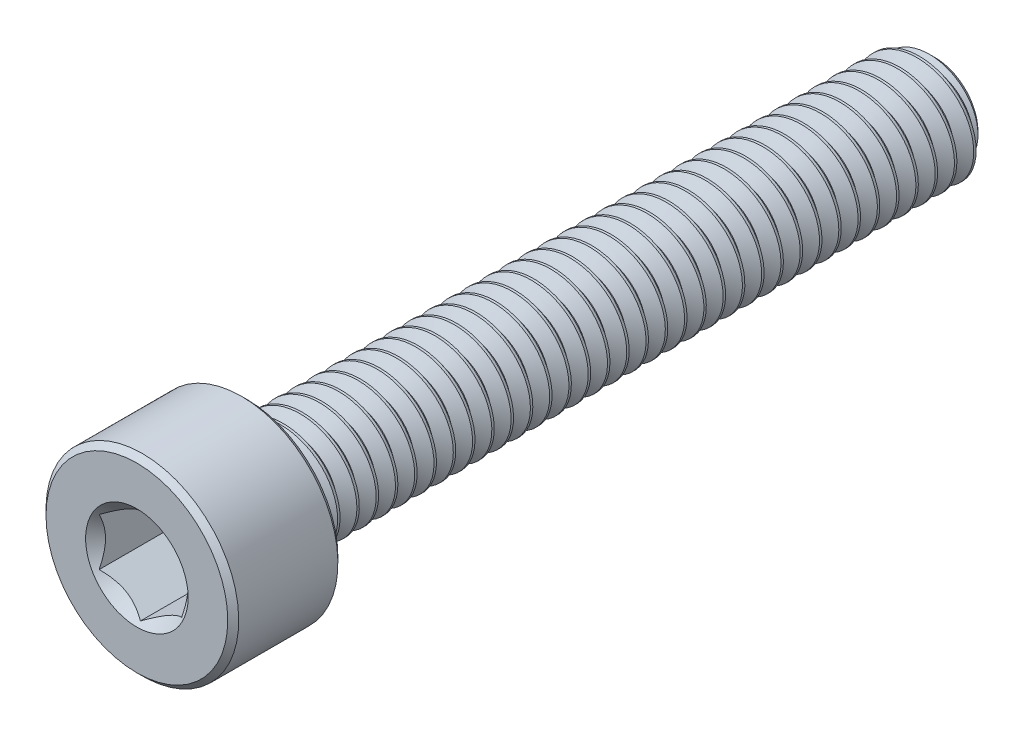
from build123d import *

# Parameters (mm, degrees)
CUT_EXTRUDE1_DEPTH     = 3
SPLIT1_SURFACE_1_BACK  = 31.643
SPLIT1_SURFACE_1_DEPTH = 63.286
SPLIT1_SURFACE_2_BACK  = 31.643
SPLIT1_SURFACE_2_DEPTH = 63.286
CUT_SWEEP1_PITCH       = 0.7
CUT_SWEEP1_TO          = 24.8


with BuildPart() as part:
    # Sketch2 → Revolve1 (revolve)
    with BuildSketch(Plane(origin=(0, 0, 0), x_dir=(0, 0, -1), z_dir=(1, 0, 0))):
        with BuildLine():
            Line((-14.5, 0), (-14.5, 3.3))
            Line((-14.5, 3.3), (-14.3, 3.5))
            Line((-14.3, 3.5), (-10.7, 3.5))
            Line((-10.7, 3.5), (-10.5, 3.3))
            Line((-10.5, 3.3), (-10.5, 2.2))
            ThreePointArc((-10.5, 2.2), (-10.441421356, 2.058578644), (-10.3, 2))
            Line((-10.3, 2), (14.045336663, 2))
            Line((14.045336663, 2), (14.5, 1.545336663))
            Line((14.5, 1.545336663), (14.5, 0))
            Line((14.5, 0), (-14.5, 0))
        make_face()
    revolve(axis=Axis((0, 0, -14.5), (0, 0, 1)))

    # Sketch3 → Cut-Extrude1 (cut)
    with BuildSketch(Plane.XY.offset(14.5)):
        Polygon((1.5, -0.866025404), (1.5, 0.866025404), (0, 1.732050808), (-1.5, 0.866025404), (-1.5, -0.866025404), (0, -1.732050808), align=None)
    extrude(amount=-CUT_EXTRUDE1_DEPTH, mode=Mode.SUBTRACT)

    # Cut-Extrude2 cone 1 section (through the dimple's axis) → Cut-Extrude2 (revolve, cut)
    with BuildSketch(Plane(origin=(0, 0, 14.5), x_dir=(0, -1, 0), z_dir=(1, 0, 0))):
        Polygon((0, 0), (1.861954618, 0), (0, 1.861954618), align=None)
    revolve(axis=Axis((0, 0, 14.5), (0, 0, -1)), mode=Mode.SUBTRACT)


with BuildPart() as body_2:
    # Split1: the piece behind the surface
    add(part.part)
    # Split1 surface: a surface, the sketch's curves swept straight by 63.286 mm
    with BuildLine(Plane(origin=(0, 0, 0), x_dir=(0, 0, -1), z_dir=(1, 0, 0)).offset(-SPLIT1_SURFACE_1_BACK), mode=Mode.PRIVATE) as split1_surface_1_path:
        Line((-10.3, -3.5), (-10.3, 3.5))
    split1_surface_1 = Shell.extrude(split1_surface_1_path.wire(), (1 * SPLIT1_SURFACE_1_DEPTH, 0 * SPLIT1_SURFACE_1_DEPTH, 0 * SPLIT1_SURFACE_1_DEPTH))
    split(bisect_by=split1_surface_1, keep=Keep.BOTTOM)

    # Cut-Sweep1: arcs per turn and ends read off the stored shape
    # Cut-Sweep1: the profile of Sketch7 screwed along a right-hand helix through 36.714286 turns, 6 arcs to a turn; built about Z, then put on its axis
    cut_sweep1_z = Axis((0, 0, 0), (0, 0, 1))
    cut_sweep1_corners = [(2.037888611, 0, 0.021875), (2.037888611, 0, -0.634375), (1.545336663, 0, -0.35), (1.545336663, 0, -0.2625)]
    with BuildLine(mode=Mode.PRIVATE) as cut_sweep1_profile:
        Line(cut_sweep1_corners[0], cut_sweep1_corners[1])
        Line(cut_sweep1_corners[1], cut_sweep1_corners[2])
        Line(cut_sweep1_corners[2], cut_sweep1_corners[3])
        Line(cut_sweep1_corners[3], cut_sweep1_corners[0])
    cut_sweep1_cap = Face(cut_sweep1_profile.wire())
    cut_sweep1_turn_angles = [0, 30, 60, 90, 120, 150, 180, 210, 240, 270, 300, 330, 360]
    cut_sweep1_turn_weights = [1, 0.8660254037844387, 1, 0.8660254037844387, 1, 0.8660254037844387, 1, 0.8660254037844387, 1, 0.8660254037844387, 1, 0.8660254037844387, 1]
    cut_sweep1_turn_rails = [Edge.make_bspline([Vector(p[0], p[1], 0).rotate(cut_sweep1_z, cut_sweep1_turn_angles[k]) / cut_sweep1_turn_weights[k] + Vector(0, 0, p[2] + CUT_SWEEP1_PITCH * cut_sweep1_turn_angles[k] / 360) for k in range(13)], [0, 0, 0, 1, 1, 2, 2, 3, 3, 4, 4, 5, 5, 6, 6, 6], 2, cut_sweep1_turn_weights) for p in cut_sweep1_corners]
    cut_sweep1_turn_sides = [Face.make_surface_from_curves(cut_sweep1_turn_rails[p[0]], cut_sweep1_turn_rails[p[1]]) for p in [(0, 1), (1, 2), (2, 3), (3, 0)]]
    cut_sweep1_last_angles = [12960, 12990, 13020, 13050, 13080, 13110, 13140, 13170, 13200, 13208.571428571, 13217.142857142]
    cut_sweep1_last_weights = [1, 0.8660254037844387, 1, 0.8660254037844387, 1, 0.8660254037844387, 1, 0.8660254037844387, 1, 0.9888308262256825, 1]
    cut_sweep1_last_rails = [Edge.make_bspline([Vector(p[0], p[1], 0).rotate(cut_sweep1_z, cut_sweep1_last_angles[k]) / cut_sweep1_last_weights[k] + Vector(0, 0, p[2] + CUT_SWEEP1_PITCH * cut_sweep1_last_angles[k] / 360) for k in range(11)], [0, 0, 0, 1, 1, 2, 2, 3, 3, 4, 4, 5, 5, 5], 2, cut_sweep1_last_weights) for p in cut_sweep1_corners]
    cut_sweep1_last_sides = [Face.make_surface_from_curves(cut_sweep1_last_rails[p[0]], cut_sweep1_last_rails[p[1]]) for p in [(0, 1), (1, 2), (2, 3), (3, 0)]]
    cut_sweep1 = Plane(origin=(0, 0, -14.5), x_dir=(0, 1, 0), z_dir=(0, 0, 1)) * split(Solid(Shell([*[p.moved(Location((0, 0, CUT_SWEEP1_PITCH * i))) for i in range(36) for p in cut_sweep1_turn_sides], *cut_sweep1_last_sides, cut_sweep1_cap, cut_sweep1_cap.rotate(cut_sweep1_z, 13217.142857142).moved(Location((0, 0, CUT_SWEEP1_PITCH * 13217.142857142 / 360)))])), bisect_by=Plane.XY.offset(CUT_SWEEP1_TO), keep=Keep.BOTTOM, mode=Mode.PRIVATE)
    add(cut_sweep1, mode=Mode.SUBTRACT)


with BuildPart() as part_1:
    add(part.part)

    # Split1: split by a surface, the side it looks to stays
    # Split1 surface: a surface, the sketch's curves swept straight by 63.286 mm
    with BuildLine(Plane(origin=(0, 0, 0), x_dir=(0, 0, -1), z_dir=(1, 0, 0)).offset(-SPLIT1_SURFACE_2_BACK), mode=Mode.PRIVATE) as split1_surface_2_path:
        Line((-10.3, -3.5), (-10.3, 3.5))
    split1_surface_2 = Shell.extrude(split1_surface_2_path.wire(), (1 * SPLIT1_SURFACE_2_DEPTH, 0 * SPLIT1_SURFACE_2_DEPTH, 0 * SPLIT1_SURFACE_2_DEPTH))
    split(bisect_by=split1_surface_2, keep=Keep.TOP)

    add(body_2.part)  # Revolve2 merges body 2
    # Sketch8 → Revolve2 (revolve)
    with BuildSketch(Plane(origin=(0, 0, 0), x_dir=(0, 0, -1), z_dir=(1, 0, 0)), mode=Mode.PRIVATE) as revolve2_sk:
        Polygon((-10.5, 0), (-10.5, 2), (-10.3, 2), (-9.145299462, 0), align=None)
    revolve(revolve2_sk.sketch.rotate(Axis((0, 0, 9.145299462), (0, 0, 1)), 270), axis=Axis((0, 0, 9.145299462), (0, 0, 1)))


solid = part_1.part
